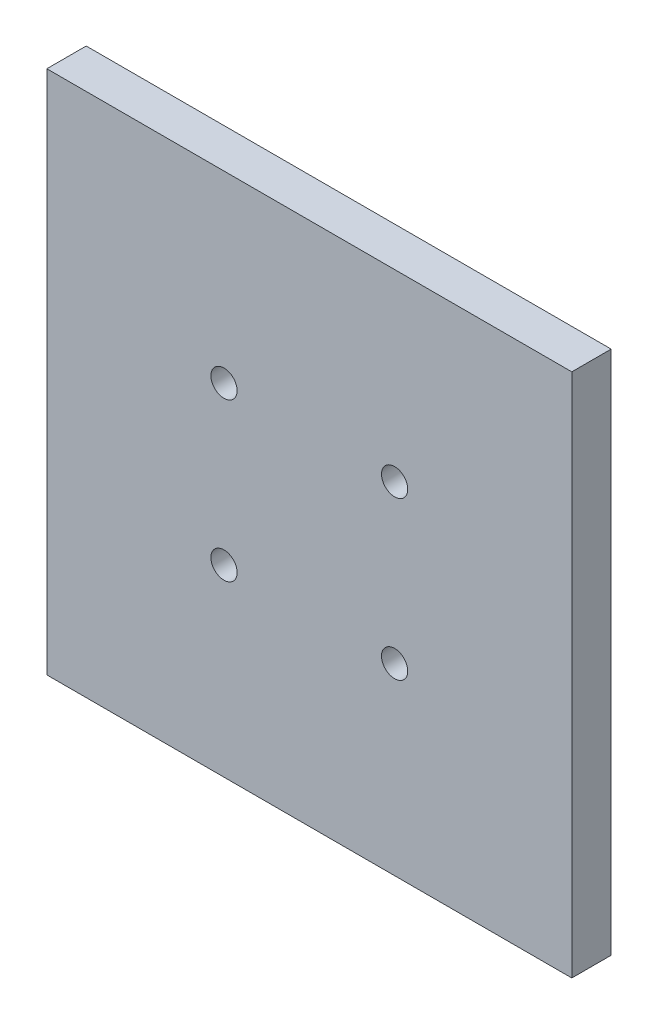
from build123d import *

# Parameters (mm, degrees)
SKETCH1_W           = 40
SKETCH1_H           = 40
SKETCH1_R           = 1
BOSS_EXTRUDE1_DEPTH = 3


with BuildPart() as part:
    # Sketch1 → Boss-Extrude1 (new body)
    with BuildSketch(Plane.XY):
        Rectangle(SKETCH1_W, SKETCH1_H)
        with Locations((6.5, -6)):
            Circle(SKETCH1_R, mode=Mode.SUBTRACT)
        with Locations((-6.5, -6)):
            Circle(SKETCH1_R, mode=Mode.SUBTRACT)
        with Locations((6.5, 6)):
            Circle(SKETCH1_R, mode=Mode.SUBTRACT)
        with Locations((-6.5, 6)):
            Circle(SKETCH1_R, mode=Mode.SUBTRACT)
    extrude(amount=BOSS_EXTRUDE1_DEPTH)


solid = part.part
